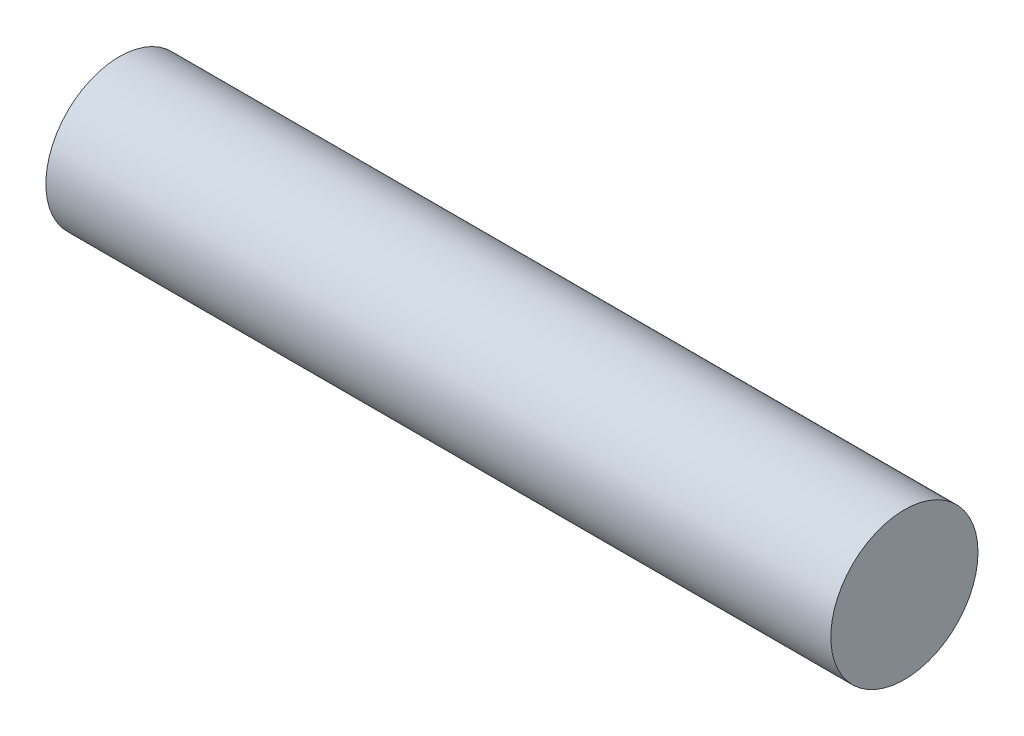
from build123d import *

# Parameters (mm, degrees)
SKETCH_1_R      = 3
EXTRUDE_1_DEPTH = 16


with BuildPart() as part:
    # Эскиз1 → Бобышка-Вытянуть1 (new, symmetric)
    with BuildSketch(Plane(origin=(0, 0, 0), x_dir=(0, 0, -1), z_dir=(1, 0, 0))):
        Circle(SKETCH_1_R)
    extrude(amount=EXTRUDE_1_DEPTH, both=True)


solid = part.part
